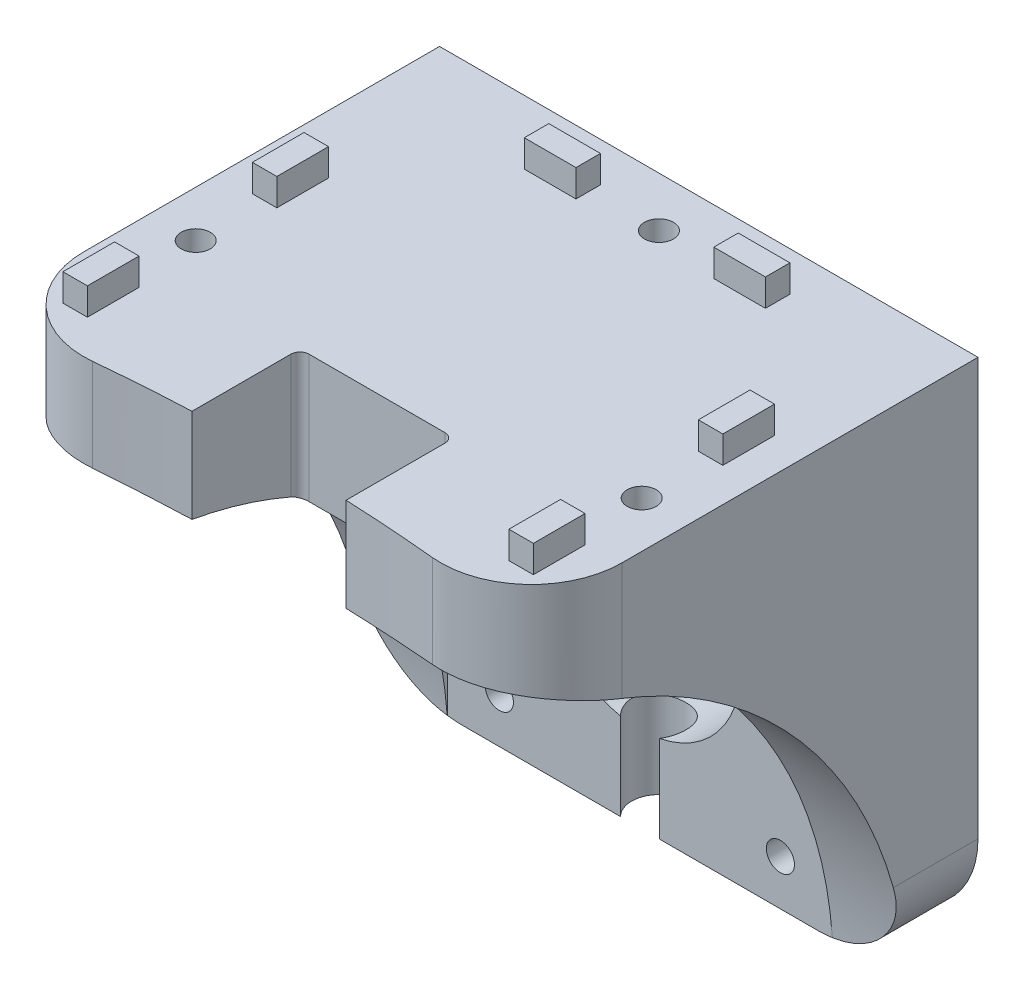
from build123d import *

# Parameters (mm, degrees)
CROQUIS1_W              = 59.4
CROQUIS1_H              = 48.6
SALIENTE_EXTRUIR1_DEPTH = 56
CROQUIS2_W              = 5.9
CROQUIS2_H              = 2.9
CROQUIS2_W_2            = 2.9
CROQUIS2_H_2            = 5.9
SALIENTE_EXTRUIR2_DEPTH = 3
CROQUIS3_R              = 1.6
CORTAR_EXTRUIR1_DEPTH   = 56
CROQUIS4_R              = 11.1
CROQUIS4_R_2            = 1.55
CORTAR_EXTRUIR2_DEPTH   = 48.6
CROQUIS5_W              = 42.5
CROQUIS5_H              = 42.5
CORTAR_EXTRUIR3_DEPTH   = 43
CROQUIS7_R              = 3
CORTAR_EXTRUIR4_DEPTH   = 50
CORTAR_EXTRUIR5_REACH   = 98.806
CORTAR_EXTRUIR6_DEPTH   = 96.006947287
SALIENTE_EXTRUIR3_START = 2
CROQUIS10_W             = 59.4
CROQUIS10_H             = 56
CROQUIS10_R             = 1.55
CROQUIS10_R_2           = 11.1
SALIENTE_EXTRUIR3_DEPTH = 2
REDONDEO1_R             = 10
REDONDEO2_R             = 10
REDONDEO3_R             = 1
CROQUIS11_R             = 3.25
CORTAR_EXTRUIR7_DEPTH   = 3.5
REDONDEO4_R             = 1
CROQUIS12_W             = 5.9
CROQUIS12_H             = 2.9
CROQUIS12_W_2           = 5.7
CROQUIS12_H_2           = 2.7
CROQUIS12_W_3           = 2.9
CROQUIS12_H_3           = 5.9
CROQUIS12_W_4           = 2.7
CROQUIS12_H_4           = 5.7
CORTAR_EXTRUIR9_DEPTH   = 3
REDONDEO5_R             = 0.5


with BuildPart() as part:
    # Croquis1 → Saliente-Extruir1 (new body)
    with BuildSketch(Plane(origin=(0, 0, 0), x_dir=(1, 0, 0), z_dir=(0, 1, 0))):
        with Locations((29.7, 24.3)):
            Rectangle(CROQUIS1_W, CROQUIS1_H)
    extrude(amount=SALIENTE_EXTRUIR1_DEPTH)

    # Croquis2 → Saliente-Extruir2 (add)
    with BuildSketch(Plane(origin=(0, 56, 0), x_dir=(1, 0, 0), z_dir=(0, 1, 0))):
        with Locations((40.15, 44.9)):
            Rectangle(CROQUIS2_W, CROQUIS2_H)
        with Locations((19.25, 44.9)):
            Rectangle(CROQUIS2_W, CROQUIS2_H)
        with Locations((5.1, 29.05)):
            Rectangle(CROQUIS2_W_2, CROQUIS2_H_2)
        with Locations((5.1, 8.15)):
            Rectangle(CROQUIS2_W_2, CROQUIS2_H_2)
        with Locations((54.3, 8.15)):
            Rectangle(CROQUIS2_W_2, CROQUIS2_H_2)
        with Locations((54.3, 29.05)):
            Rectangle(CROQUIS2_W_2, CROQUIS2_H_2)
    extrude(amount=SALIENTE_EXTRUIR2_DEPTH)

    # Croquis3 → Cortar-Extruir1 (cut)
    with BuildSketch(Plane(origin=(0, 56, 0), x_dir=(1, 0, 0), z_dir=(0, 1, 0))):
        with Locations(Location((29.7, 45.1, 0), (0, 0, 270))):
            Circle(CROQUIS3_R)
        with Locations(Location((5.1, 18.6, 0), (0, 0, 270))):
            Circle(CROQUIS3_R)
        with Locations(Location((54.3, 18.6, 0), (0, 0, 90))):
            Circle(CROQUIS3_R)
    extrude(amount=-CORTAR_EXTRUIR1_DEPTH, mode=Mode.SUBTRACT)

    # Croquis4 → Cortar-Extruir2 (cut)
    with BuildSketch(Plane(origin=(0, 0, -48.6), x_dir=(-1, 0, 0), z_dir=(0, 0, -1))):
        with Locations((-29.7, 20.5)):
            Circle(CROQUIS4_R)
        with Locations((-45.2, 36)):
            Circle(CROQUIS4_R_2)
        with Locations((-14.2, 36)):
            Circle(CROQUIS4_R_2)
        with Locations((-45.2, 5)):
            Circle(CROQUIS4_R_2)
        with Locations((-14.2, 5)):
            Circle(CROQUIS4_R_2)
    extrude(amount=-CORTAR_EXTRUIR2_DEPTH, mode=Mode.SUBTRACT)

    # Croquis5 → Cortar-Extruir3 (cut)
    with BuildSketch(Plane.XY):
        with Locations((29.7, 20.5)):
            Rectangle(CROQUIS5_W, CROQUIS5_H)
    extrude(amount=-CORTAR_EXTRUIR3_DEPTH, mode=Mode.SUBTRACT)

    # Croquis7 → Cortar-Extruir4 (cut)
    with BuildSketch(Plane(origin=(0, 0, 0), x_dir=(1, 0, 0), z_dir=(0, 1, 0))):
        with Locations(Location((29.7, 45.1, 0), (0, 0, 224.427004001))):
            Circle(CROQUIS7_R)
        with Locations(Location((5.1, 18.6, 0), (0, 0, 270))):
            Circle(CROQUIS7_R)
        with Locations(Location((54.3, 18.6, 0), (0, 0, 270))):
            Circle(CROQUIS7_R)
    extrude(amount=CORTAR_EXTRUIR4_DEPTH, mode=Mode.SUBTRACT)

    # Cortar-Extruir5: up to this face of the body (flat: up to its plane)
    cortar_extruir5_end = Plane(part.part.faces().sort_by_distance((0, 28, -24.3))[0])
    # Croquis8 → Cortar-Extruir5 (cut, up to the picked face)
    with BuildSketch(Plane(origin=(59.4, 0, 0), x_dir=(0, 0, -1), z_dir=(1, 0, 0)), mode=Mode.PRIVATE) as cortar_extruir5_sk1:
        with BuildLine():
            Line((43, 0), (0, 0))
            Line((0, 0), (0, 46))
            ThreePointArc((0, 46), (29.650758467, 30.619187262), (43, 0))
        make_face()
    cortar_extruir5_tool1 = split(extrude(cortar_extruir5_sk1.sketch, amount=-CORTAR_EXTRUIR5_REACH, mode=Mode.PRIVATE), bisect_by=cortar_extruir5_end, keep=Keep.BOTH, mode=Mode.PRIVATE)
    add(cortar_extruir5_tool1.solids().sort_by(Axis((59.4, 18.844138, -17.750957), (-1, 0, 0)))[0], mode=Mode.SUBTRACT)

    # Croquis9 → Cortar-Extruir6 (cut, through all)
    with BuildSketch(Plane(origin=(0, 56, 0), x_dir=(1, 0, 0), z_dir=(0, 1, 0))):
        with BuildLine():
            Line((0, 0), (59.4, 0))
            ThreePointArc((59.4, 0), (48.828557379, 1.334563088), (38.2, 2.089696043))
            Line((38.2, 2.089696043), (38.2, 14))
            Line((38.2, 14), (21.2, 14))
            Line((21.2, 14), (21.2, 2.089696043))
            ThreePointArc((21.2, 2.089696043), (10.571442621, 1.334563088), (0, 0))
        make_face()
    extrude(amount=-CORTAR_EXTRUIR6_DEPTH, mode=Mode.SUBTRACT)

    # Croquis10 → Saliente-Extruir3 (add)
    with BuildSketch(Plane(origin=(0, 0, -48.6), x_dir=(-1, 0, 0), z_dir=(0, 0, -1)).offset(SALIENTE_EXTRUIR3_START)):
        with Locations((-29.7, 28)):
            Rectangle(CROQUIS10_W, CROQUIS10_H)
        with Locations((-14.2, 36)):
            Circle(CROQUIS10_R, mode=Mode.SUBTRACT)
        with Locations((-45.2, 36)):
            Circle(CROQUIS10_R, mode=Mode.SUBTRACT)
        with Locations((-45.2, 5)):
            Circle(CROQUIS10_R, mode=Mode.SUBTRACT)
        with Locations((-29.7, 20.5)):
            Circle(CROQUIS10_R_2, mode=Mode.SUBTRACT)
        with Locations((-14.2, 5)):
            Circle(CROQUIS10_R, mode=Mode.SUBTRACT)
    extrude(amount=-SALIENTE_EXTRUIR3_DEPTH)

    # Redondeo1
    # the kernel refuses this fillet: 10 mm, written as the material it takes off along each edge
    with BuildSketch(Plane(origin=(59.4, 0, -18), x_dir=(0, 1, 0), z_dir=(0, 0, -1)), Plane(origin=(0, 0, -18), x_dir=(1, 0, 0), z_dir=(0, 0, -1))) as redondeo1_piece_1:
        with BuildLine():
            CenterArc((REDONDEO1_R, -REDONDEO1_R), REDONDEO1_R, 90, 90)
            Line((0, -REDONDEO1_R), (0, 0))
            Line((0, 0), (REDONDEO1_R, 0))
        make_face()
    extrude(amount=57.6, mode=Mode.SUBTRACT)

    # Redondeo2
    redondeo2_edges = [part.edges().sort_by_distance(p)[0] for p in [
        (0, 51, 0),
        (59.4, 51, 0),
    ]]
    fillet(redondeo2_edges, radius=REDONDEO2_R)

    # Redondeo3
    redondeo3_edges = [part.edges().sort_by_distance(p)[0] for p in [
        (21.2, 48.954284551, -14),
        (38.2, 48.954284551, -14),
    ]]
    fillet(redondeo3_edges, radius=REDONDEO3_R)

    # Croquis11 → Cortar-Extruir7 (cut)
    with BuildSketch(Plane(origin=(0, 0, -50.6), x_dir=(-1, 0, 0), z_dir=(0, 0, -1))):
        with Locations((-45.2, 36)):
            Circle(CROQUIS11_R)
        with Locations((-14.2, 36)):
            Circle(CROQUIS11_R)
        with Locations((-14.2, 5)):
            Circle(CROQUIS11_R)
        with Locations((-45.2, 5)):
            Circle(CROQUIS11_R)
    extrude(amount=-CORTAR_EXTRUIR7_DEPTH, mode=Mode.SUBTRACT)

    # Redondeo4
    redondeo4_edges = [part.edges().sort_by_distance(p)[0] for p in [
        (48.45, 5, -47.1),
        (17.45, 5, -47.1),
        (17.45, 36, -47.1),
        (48.45, 36, -47.1),
    ]]
    fillet(redondeo4_edges, radius=REDONDEO4_R)

    # Croquis12 → Cortar-Extruir9 (cut)
    # profile 1 of 6: a face of its own
    with BuildSketch(Plane(origin=(0, 59, 0), x_dir=(1, 0, 0), z_dir=(0, 1, 0))):
        with Locations((19.25, 44.9)):
            Rectangle(CROQUIS12_W, CROQUIS12_H)
        with Locations((19.25, 44.9)):
            Rectangle(CROQUIS12_W_2, CROQUIS12_H_2, mode=Mode.SUBTRACT)
    # profile 2 of 6: a face of its own
    with BuildSketch(Plane(origin=(0, 59, 0), x_dir=(1, 0, 0), z_dir=(0, 1, 0))):
        with Locations((40.15, 44.9)):
            Rectangle(CROQUIS12_W, CROQUIS12_H)
        with Locations((40.15, 44.9)):
            Rectangle(CROQUIS12_W_2, CROQUIS12_H_2, mode=Mode.SUBTRACT)
    # profile 3 of 6: a face of its own
    with BuildSketch(Plane(origin=(0, 59, 0), x_dir=(1, 0, 0), z_dir=(0, 1, 0))):
        with Locations((54.3, 29.05)):
            Rectangle(CROQUIS12_W_3, CROQUIS12_H_3)
        with Locations((54.3, 29.05)):
            Rectangle(CROQUIS12_W_4, CROQUIS12_H_4, mode=Mode.SUBTRACT)
    # profile 4 of 6: a face of its own
    with BuildSketch(Plane(origin=(0, 59, 0), x_dir=(1, 0, 0), z_dir=(0, 1, 0))):
        with Locations((54.3, 8.15)):
            Rectangle(CROQUIS12_W_3, CROQUIS12_H_3)
        with Locations((54.3, 8.15)):
            Rectangle(CROQUIS12_W_4, CROQUIS12_H_4, mode=Mode.SUBTRACT)
    # profile 5 of 6: a face of its own
    with BuildSketch(Plane(origin=(0, 59, 0), x_dir=(1, 0, 0), z_dir=(0, 1, 0))):
        with Locations((5.1, 8.15)):
            Rectangle(CROQUIS12_W_3, CROQUIS12_H_3)
        with Locations((5.1, 8.15)):
            Rectangle(CROQUIS12_W_4, CROQUIS12_H_4, mode=Mode.SUBTRACT)
    # profile 6 of 6: a face of its own
    with BuildSketch(Plane(origin=(0, 59, 0), x_dir=(1, 0, 0), z_dir=(0, 1, 0))):
        with Locations((5.1, 29.05)):
            Rectangle(CROQUIS12_W_3, CROQUIS12_H_3)
        with Locations((5.1, 29.05)):
            Rectangle(CROQUIS12_W_4, CROQUIS12_H_4, mode=Mode.SUBTRACT)
    extrude(amount=-CORTAR_EXTRUIR9_DEPTH, mode=Mode.SUBTRACT)

    # Redondeo5
    redondeo5_edges = [part.edges().sort_by_distance(p)[0] for p in [
        (48.45, 5, -50.6),
        (17.45, 5, -50.6),
        (17.45, 36, -50.6),
        (48.45, 36, -50.6),
    ]]
    fillet(redondeo5_edges, radius=REDONDEO5_R)


solid = part.part
